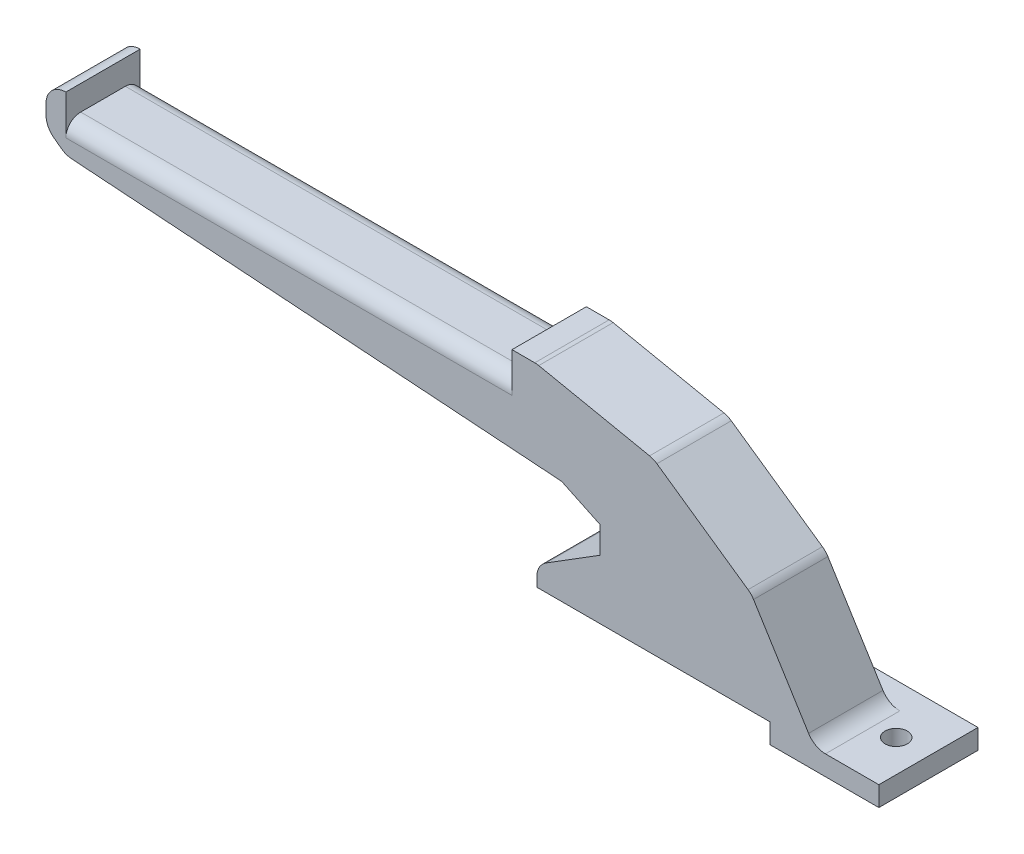
from build123d import *

# Parameters (mm, degrees)
BOSS_EXTRU_1_DEPTH   = 15
CONG_1_R             = 3
CONG_2_R             = 4
ESQUISSE2_W          = 22
ESQUISSE2_H          = 4
BOSS_EXTRU_2_DEPTH   = 5
D_GAGEMENT_M41_D     = 4.5
D_GAGEMENT_M41_DEPTH = 16


with BuildPart() as part:
    # Esquisse1 → Boss.-Extru.1 (new body)
    with BuildSketch(Plane.XY):
        Polygon((0, 0), (-22, 0), (-22, 4), (-69, 4), (-69, 8), (-56.26016699, 15.95016153), (-56.26016699, 21.33814045), (-64, 25), (-164, 32), (-168, 35), (-168, 43), (-164, 43), (-164, 38), (-74, 38), (-74, 43), (-69, 43), (-45.444881322, 38.157051099), (-25.711083844, 24.413870713), (-13, 4), (0, 4), align=None)
    extrude(amount=BOSS_EXTRU_1_DEPTH)

    # Congé1
    cong_1_edges = [part.edges().sort_by_distance(p)[0] for p in [
        (-119, 38, 0),
        (-119, 38, 15),
    ]]
    fillet(cong_1_edges, radius=CONG_1_R)

    # Congé2
    cong_2_edges = [part.edges().sort_by_distance(p)[0] for p in [
        (-69, 8, 7.5),
        (-164, 32, 7.5),
        (-168, 35, 7.5),
        (-168, 43, 7.5),
        (-69, 43, 7.5),
        (-45.444881322, 38.157051099, 7.5),
        (-25.711083844, 24.413870713, 7.5),
        (-13, 4, 7.5),
    ]]
    fillet(cong_2_edges, radius=CONG_2_R - 0.0001)  # a hair under: the kernel refuses the full size

    # Esquisse2 → Boss.-Extru.2 (add)
    with BuildSketch(Plane(origin=(0, 0, 0), x_dir=(-1, 0, 0), z_dir=(0, 0, -1))):
        with Locations((11, 2)):
            Rectangle(ESQUISSE2_W, ESQUISSE2_H)
    extrude(amount=BOSS_EXTRU_2_DEPTH)

    # Dégagement M41
    with Locations(Plane(origin=(0, 4, 0), x_dir=(1, 0, 0), z_dir=(0, 1, 0))):
        with Locations((-6.5, -5)):
            Hole(D_GAGEMENT_M41_D / 2, depth=D_GAGEMENT_M41_DEPTH)


solid = part.part
